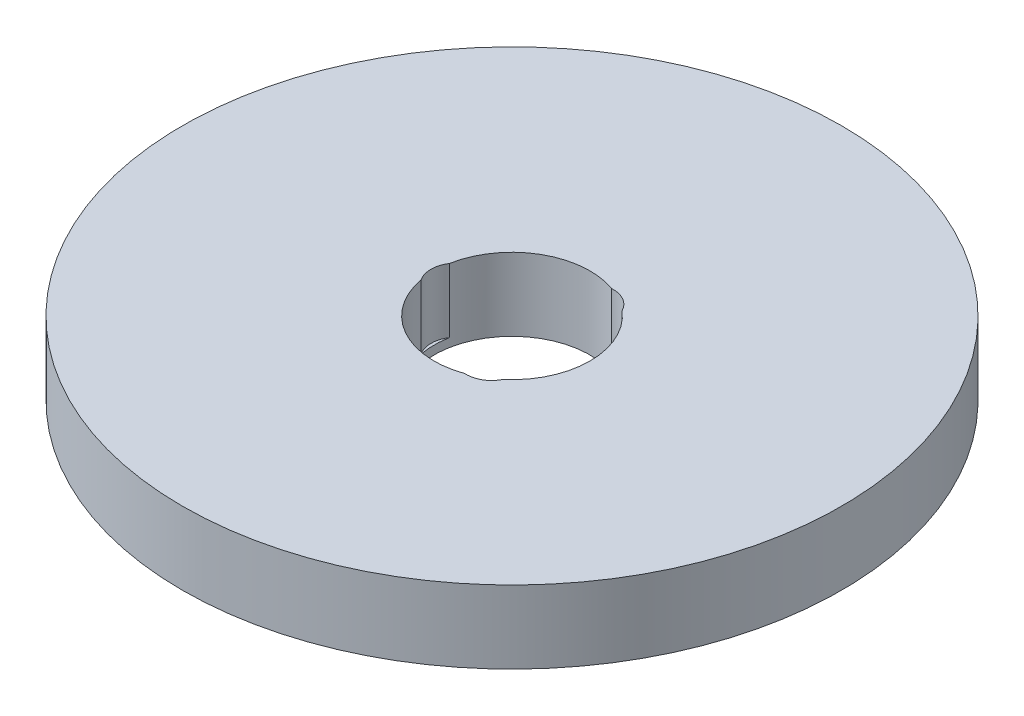
from build123d import *

# Parameters (mm, degrees)
SKETCH1_R           = 95
BOSS_EXTRUDE1_DEPTH = 21
SKETCH2_R           = 22.5
CUT_EXTRUDE1_DEPTH  = 136.981616405
SKETCH3_R           = 7.383932044
CUT_EXTRUDE2_DEPTH  = 18.521867456
CIRPATTERN1_COUNT   = 3


with BuildPart() as part:
    # Sketch1 → Boss-Extrude1 (new body)
    with BuildSketch(Plane(origin=(0, 0, 0), x_dir=(1, 0, 0), z_dir=(0, 1, 0))):
        Circle(SKETCH1_R)
    extrude(amount=BOSS_EXTRUDE1_DEPTH)

    # Sketch2 → Cut-Extrude1 (cut, through all)
    with BuildSketch(Plane(origin=(0, 0, 0), x_dir=(1, 0, 0), z_dir=(0, 1, 0))):
        Circle(SKETCH2_R)
    extrude(amount=CUT_EXTRUDE1_DEPTH, mode=Mode.SUBTRACT)

    # Sketch3 → Cut-Extrude2 (cut)
    with BuildSketch(Plane(origin=(0, 21, 0), x_dir=(1, 0, 0), z_dir=(0, 1, 0))):
        with Locations((-15.958730255, 0)):
            Circle(SKETCH3_R)
    cut_extrude2 = extrude(amount=-CUT_EXTRUDE2_DEPTH, mode=Mode.SUBTRACT)

    # CirPattern1: Cut-Extrude2 ×3 about axis
    cirpattern1_axis = Axis((0, 0, 0), (0, 1, 0))
    for i in range(1, CIRPATTERN1_COUNT):
        add(cut_extrude2.rotate(cirpattern1_axis, i * 360 / CIRPATTERN1_COUNT), mode=Mode.SUBTRACT)


solid = part.part
